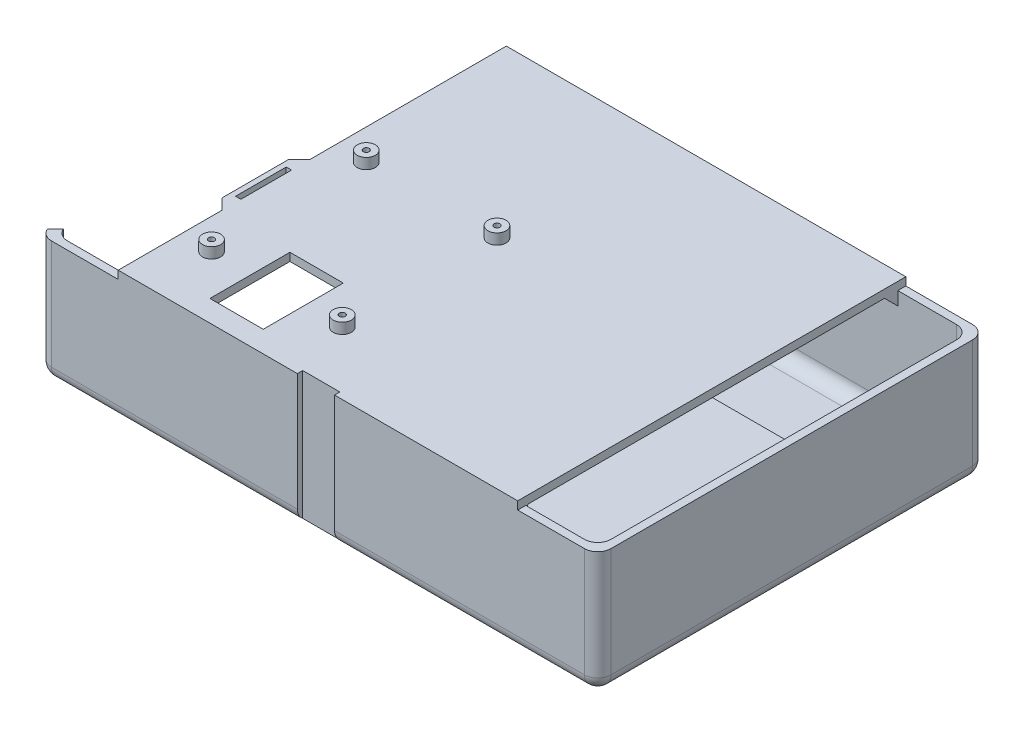
from build123d import *

# Parameters (mm, degrees)
SKETCH1_W           = 209.76981502
SKETCH1_H           = 145.49880751
BOSS_EXTRUDE1_DEPTH = 3
SKETCH2_W           = 209.76981502
SKETCH2_H           = 145.49880751
SKETCH2_W_2         = 203.76981502
SKETCH2_H_2         = 139.49880751
BOSS_EXTRUDE2_DEPTH = 43
CUT_EXTRUDE1_REACH  = 237.338
SKETCH3_W           = 128.479051628
SKETCH3_H           = 43
FILLET1_R           = 5
FILLET2_R           = 5
SKETCH4_W           = 149.76981502
SKETCH4_H           = 145.49880751
BOSS_EXTRUDE3_DEPTH = 3
SKETCH6_R           = 3.4
SKETCH6_R_2         = 1.1
BOSS_EXTRUDE4_DEPTH = 4
CUT_EXTRUDE3_REACH  = 159.189
CUT_EXTRUDE4_REACH  = 157.634
SKETCH6_3_R         = 1.1
SKETCH10_W          = 13.938
SKETCH10_H          = 2
CUT_EXTRUDE7_DEPTH  = 49
BOSS_EXTRUDE7_DEPTH = 3
CHAMFER2_SIZE       = 5
BOSS_EXTRUDE8_DEPTH = 166.769815019
CUT_EXTRUDE8_REACH  = 189.845
CHAMFER3_SIZE       = 5
CHAMFER4_SIZE       = 1
CUT_EXTRUDE9_REACH  = 157.634
SKETCH14_W          = 20
SKETCH14_H          = 30
CHAMFER5_SIZE       = 2
CUT_EXTRUDE11_REACH = 152.937


with BuildPart() as part:
    # Sketch1 → Boss-Extrude1 (new body)
    with BuildSketch(Plane(origin=(0, 0, 0), x_dir=(1, 0, 0), z_dir=(0, 1, 0))):
        with Locations((-1.81641925, -29.789838466)):
            Rectangle(SKETCH1_W, SKETCH1_H)
    extrude(amount=BOSS_EXTRUDE1_DEPTH)

    # Sketch2 → Boss-Extrude2 (add)
    with BuildSketch(Plane(origin=(0, 3, 0), x_dir=(1, 0, 0), z_dir=(0, 1, 0))):
        with Locations((-1.81641925, -29.789838466)):
            Rectangle(SKETCH2_W, SKETCH2_H)
        with Locations((-1.81641925, -29.789838466)):
            Rectangle(SKETCH2_W_2, SKETCH2_H_2, mode=Mode.SUBTRACT)
    extrude(amount=BOSS_EXTRUDE2_DEPTH)

    # Sketch3 → Cut-Extrude1 (cut, up to next)
    with BuildSketch(Plane(origin=(-103.70132676, 0, 0), x_dir=(0, 0, -1), z_dir=(1, 0, 0)), mode=Mode.PRIVATE) as cut_extrude1_sk1:
        with Locations((-30.028651676, 24.5)):
            Rectangle(SKETCH3_W, SKETCH3_H)
    cut_extrude1_tool1 = extrude(cut_extrude1_sk1.sketch, amount=-CUT_EXTRUDE1_REACH, mode=Mode.PRIVATE) & part.part
    add(cut_extrude1_tool1.solids().sort_by_distance((-103.701327, 24.5, 30.028652))[0], mode=Mode.SUBTRACT)

    # Fillet1
    fillet1_edges = [part.edges().sort_by_distance(p)[0] for p in [
        (100.06848826, 24.5, -39.959565289),
        (100.06848826, 24.5, 99.539242221),
        (-103.70132676, 24.5, 99.539242221),
        (-103.70132676, 24.5, -39.959565289),
        (-106.70132676, 23, -42.959565289),
        (103.06848826, 23, -42.959565289),
        (103.06848826, 23, 102.539242221),
        (-106.70132676, 23, 102.539242221),
    ]]
    fillet(fillet1_edges, radius=FILLET1_R)

    # Fillet2
    # the kernel refuses this fillet: 5 mm, written as the material it adds along each edge
    with BuildSketch(Plane(origin=(-103.70132676, 3, 94.26817749), x_dir=(0, 1, 0), z_dir=(0, 0, 1))) as fillet2_piece_1:
        with BuildLine():
            CenterArc((FILLET2_R, -FILLET2_R), FILLET2_R, 90, 90)
            Line((0, -FILLET2_R), (0, 0))
            Line((0, 0), (FILLET2_R, 0))
        make_face()
    extrude(amount=0.271064731)
    with BuildSketch(Plane(origin=(-98.70132676, 3, 94.539242221), x_dir=(-1, 0, 0), z_dir=(0, 0, -1))) as fillet2_piece_2:
        with BuildLine():
            CenterArc((5 - FILLET2_R, FILLET2_R), FILLET2_R, 270, 90)
            Line((5 - FILLET2_R, 0), (5, 0))
            Line((5, 0), (5, FILLET2_R))
        make_face()
    revolve(axis=Axis((-98.70132676, 3, 94.539242221), (0, 1, 0)), revolution_arc=90)
    with BuildSketch(Plane(origin=(-98.70132676, 3, 99.539242221), x_dir=(0, 1, 0), z_dir=(1, 0, 0)), Plane(origin=(95.06848826, 3, -39.959565289), x_dir=(0, 1, 0), z_dir=(-1, 0, 0))) as fillet2_piece_3:
        with BuildLine():
            CenterArc((FILLET2_R, -FILLET2_R), FILLET2_R, 90, 90)
            Line((0, -FILLET2_R), (0, 0))
            Line((0, 0), (FILLET2_R, 0))
        make_face()
    extrude(amount=193.769815019)
    with BuildSketch(Plane(origin=(95.06848826, 3, 94.539242221), x_dir=(0, 0, 1), z_dir=(-1, 0, 0))) as fillet2_piece_4:
        with BuildLine():
            CenterArc((5 - FILLET2_R, FILLET2_R), FILLET2_R, 270, 90)
            Line((5 - FILLET2_R, 0), (5, 0))
            Line((5, 0), (5, FILLET2_R))
        make_face()
    revolve(axis=Axis((95.06848826, 3, 94.539242221), (0, 1, 0)), revolution_arc=90)
    with BuildSketch(Plane(origin=(100.06848826, 3, 94.539242221), x_dir=(0, 1, 0), z_dir=(0, 0, -1))) as fillet2_piece_5:
        with BuildLine():
            CenterArc((FILLET2_R, -FILLET2_R), FILLET2_R, 90, 90)
            Line((0, -FILLET2_R), (0, 0))
            Line((0, 0), (FILLET2_R, 0))
        make_face()
    extrude(amount=129.49880751)
    with BuildSketch(Plane(origin=(95.06848826, 3, -34.959565289), x_dir=(1, 0, 0), z_dir=(0, 0, 1))) as fillet2_piece_6:
        with BuildLine():
            CenterArc((5 - FILLET2_R, FILLET2_R), FILLET2_R, 270, 90)
            Line((5 - FILLET2_R, 0), (5, 0))
            Line((5, 0), (5, FILLET2_R))
        make_face()
    revolve(axis=Axis((95.06848826, 3, -34.959565289), (0, 1, 0)), revolution_arc=90)
    with BuildSketch(Plane(origin=(-103.70132676, 3, -34.959565289), x_dir=(0, 1, 0), z_dir=(0, 0, 1))) as fillet2_piece_7:
        with BuildLine():
            CenterArc((FILLET2_R, -FILLET2_R), FILLET2_R, 90, 90)
            Line((0, -FILLET2_R), (0, 0))
            Line((0, 0), (FILLET2_R, 0))
        make_face()
    extrude(amount=0.748691151)
    with BuildSketch(Plane(origin=(-98.70132676, 3, -34.959565289), x_dir=(0, 0, -1), z_dir=(1, 0, 0))) as fillet2_piece_8:
        with BuildLine():
            CenterArc((5 - FILLET2_R, FILLET2_R), FILLET2_R, 270, 90)
            Line((5 - FILLET2_R, 0), (5, 0))
            Line((5, 0), (5, FILLET2_R))
        make_face()
    revolve(axis=Axis((-98.70132676, 3, -34.959565289), (0, 1, 0)), revolution_arc=90)
    # the kernel refuses this fillet: 5 mm, written as the material it takes off along each edge
    with BuildSketch(Plane(origin=(-101.70132676, 0, 97.539242221), x_dir=(0, 0, 1), z_dir=(1, 0, 0))) as fillet2_2_piece_1:
        with BuildLine():
            CenterArc((5 - FILLET2_R, -FILLET2_R), FILLET2_R, 0, 90)
            Line((5, -FILLET2_R), (5, 0))
            Line((5, 0), (5 - FILLET2_R, 0))
        make_face()
    revolve(axis=Axis((-101.70132676, 0, 97.539242221), (0, -1, 0)), revolution_arc=90, mode=Mode.SUBTRACT)
    with BuildSketch(Plane(origin=(-106.70132676, 0, 97.539242221), x_dir=(1, 0, 0), z_dir=(0, 0, -1)), Plane(origin=(103.06848826, 0, -37.959565289), x_dir=(-1, 0, 0), z_dir=(0, 0, 1))) as fillet2_2_piece_2:
        with BuildLine():
            CenterArc((FILLET2_R, -FILLET2_R), FILLET2_R, 90, 90)
            Line((0, -FILLET2_R), (0, 0))
            Line((0, 0), (FILLET2_R, 0))
        make_face()
    extrude(amount=135.49880751, mode=Mode.SUBTRACT)
    with BuildSketch(Plane(origin=(-101.70132676, 0, -37.959565289), x_dir=(-1, 0, 0), z_dir=(0, 0, 1))) as fillet2_2_piece_3:
        with BuildLine():
            CenterArc((5 - FILLET2_R, -FILLET2_R), FILLET2_R, 0, 90)
            Line((5, -FILLET2_R), (5, 0))
            Line((5, 0), (5 - FILLET2_R, 0))
        make_face()
    revolve(axis=Axis((-101.70132676, 0, -37.959565289), (0, -1, 0)), revolution_arc=90, mode=Mode.SUBTRACT)
    with BuildSketch(Plane(origin=(-101.70132676, 0, -42.959565289), x_dir=(0, 0, 1), z_dir=(1, 0, 0))) as fillet2_2_piece_4:
        with BuildLine():
            CenterArc((FILLET2_R, -FILLET2_R), FILLET2_R, 90, 90)
            Line((0, -FILLET2_R), (0, 0))
            Line((0, 0), (FILLET2_R, 0))
        make_face()
    extrude(amount=199.769815019, mode=Mode.SUBTRACT)
    with BuildSketch(Plane(origin=(98.06848826, 0, -37.959565289), x_dir=(1, 0, 0), z_dir=(0, 0, 1))) as fillet2_2_piece_5:
        with BuildLine():
            CenterArc((5 - FILLET2_R, FILLET2_R), FILLET2_R, 270, 90)
            Line((5, FILLET2_R), (5, 0))
            Line((5, 0), (5 - FILLET2_R, 0))
        make_face()
    revolve(axis=Axis((98.06848826, 0, -37.959565289), (0, 1, 0)), revolution_arc=90, mode=Mode.SUBTRACT)
    with BuildSketch(Plane(origin=(98.06848826, 0, 97.539242221), x_dir=(0, 0, 1), z_dir=(-1, 0, 0))) as fillet2_2_piece_6:
        with BuildLine():
            CenterArc((5 - FILLET2_R, FILLET2_R), FILLET2_R, 270, 90)
            Line((5, FILLET2_R), (5, 0))
            Line((5, 0), (5 - FILLET2_R, 0))
        make_face()
    revolve(axis=Axis((98.06848826, 0, 97.539242221), (0, 1, 0)), revolution_arc=90, mode=Mode.SUBTRACT)
    with BuildSketch(Plane(origin=(98.06848826, 0, 102.539242221), x_dir=(0, 1, 0), z_dir=(-1, 0, 0))) as fillet2_2_piece_7:
        with BuildLine():
            CenterArc((FILLET2_R, FILLET2_R), FILLET2_R, 180, 90)
            Line((0, FILLET2_R), (0, 0))
            Line((0, 0), (FILLET2_R, 0))
        make_face()
    extrude(amount=199.769815019, mode=Mode.SUBTRACT)

    # Sketch4 → Boss-Extrude3 (add)
    with BuildSketch(Plane(origin=(0, 46, 0), x_dir=(1, 0, 0), z_dir=(0, 1, 0))):
        with Locations((-1.81641925, -29.789838466)):
            Rectangle(SKETCH4_W, SKETCH4_H)
    extrude(amount=BOSS_EXTRUDE3_DEPTH)

    # Sketch6 → Boss-Extrude4 (add)
    # profile 1 of 4: a face of its own
    with BuildSketch(Plane(origin=(0, 49, 0), x_dir=(1, 0, 0), z_dir=(0, 1, 0))):
        with Locations(Location((-65.20132676, -21.039242221, 0), (0, 0, 90))):
            Circle(SKETCH6_R)
        with Locations(Location((-65.20132676, -21.039242221, 0), (0, 0, 270))):
            Circle(SKETCH6_R_2, mode=Mode.SUBTRACT)
    # profile 2 of 4: a face of its own
    with BuildSketch(Plane(origin=(0, 49, 0), x_dir=(1, 0, 0), z_dir=(0, 1, 0))):
        with Locations(Location((-65.20132676, -79.039242221, 0), (0, 0, 90))):
            Circle(SKETCH6_R)
        with Locations(Location((-65.20132676, -79.039242221, 0), (0, 0, 270))):
            Circle(SKETCH6_R_2, mode=Mode.SUBTRACT)
    # profile 3 of 4: a face of its own
    with BuildSketch(Plane(origin=(0, 49, 0), x_dir=(1, 0, 0), z_dir=(0, 1, 0))):
        with Locations(Location((-16.20132676, -21.039242221, 0), (0, 0, 90))):
            Circle(SKETCH6_R)
        with Locations(Location((-16.20132676, -21.039242221, 0), (0, 0, 270))):
            Circle(SKETCH6_R_2, mode=Mode.SUBTRACT)
    # profile 4 of 4: a face of its own
    with BuildSketch(Plane(origin=(0, 49, 0), x_dir=(1, 0, 0), z_dir=(0, 1, 0))):
        with Locations(Location((-16.20132676, -79.039242221, 0), (0, 0, 90))):
            Circle(SKETCH6_R)
        with Locations(Location((-16.20132676, -79.039242221, 0), (0, 0, 270))):
            Circle(SKETCH6_R_2, mode=Mode.SUBTRACT)
    extrude(amount=BOSS_EXTRUDE4_DEPTH)

    # Cut-Extrude3: up to this face of the body (flat: up to its plane)
    cut_extrude3_end = Plane(part.part.faces().sort_by_distance((-1.81641925, 46, 29.789838466))[0])
    # Sketch7 → Cut-Extrude3 (cut, up to the picked face)
    with BuildSketch(Plane(origin=(0, 0, 0), x_dir=(1, 0, 0), z_dir=(0, 1, 0)), mode=Mode.PRIVATE) as cut_extrude3_sk1:
        Polygon((-109.450730514, 42.959565289), (-106.825730514, 40.334565289), (-98.82632676, 32.335161534), (-66.70132676, 0.210161534), (-66.70132676, -59.789838466), (-99.07632676, -92.164838466), (-107.075730514, -100.164242221), (-109.450730514, -102.539242221), align=None)
    cut_extrude3_tool1 = split(extrude(cut_extrude3_sk1.sketch, amount=CUT_EXTRUDE3_REACH, mode=Mode.PRIVATE), bisect_by=cut_extrude3_end, keep=Keep.BOTH, mode=Mode.PRIVATE)
    add(cut_extrude3_tool1.solids().sort_by(Axis((-91.040379, 0, 29.789838), (0, 1, 0)))[0], mode=Mode.SUBTRACT)

    # Sketch6<3> → Cut-Extrude4 (cut, up to next)
    with BuildSketch(Plane(origin=(0, 49, 0), x_dir=(1, 0, 0), z_dir=(0, 1, 0)), mode=Mode.PRIVATE) as cut_extrude4_sk1:
        with Locations(Location((-65.20132676, -79.039242221, 0), (0, 0, 90))):
            Circle(SKETCH6_3_R)
    cut_extrude4_tool1 = extrude(cut_extrude4_sk1.sketch, amount=-CUT_EXTRUDE4_REACH, mode=Mode.PRIVATE) & part.part
    # Sketch6<3> → Cut-Extrude4 (cut, up to next)
    with BuildSketch(Plane(origin=(0, 49, 0), x_dir=(1, 0, 0), z_dir=(0, 1, 0)), mode=Mode.PRIVATE) as cut_extrude4_sk2:
        with Locations(Location((-65.20132676, -21.039242221, 0), (0, 0, 90))):
            Circle(SKETCH6_3_R)
    cut_extrude4_tool2 = extrude(cut_extrude4_sk2.sketch, amount=-CUT_EXTRUDE4_REACH, mode=Mode.PRIVATE) & part.part
    # Sketch6<3> → Cut-Extrude4 (cut, up to next)
    with BuildSketch(Plane(origin=(0, 49, 0), x_dir=(1, 0, 0), z_dir=(0, 1, 0)), mode=Mode.PRIVATE) as cut_extrude4_sk3:
        with Locations(Location((-16.20132676, -21.039242221, 0), (0, 0, 90))):
            Circle(SKETCH6_3_R)
    cut_extrude4_tool3 = extrude(cut_extrude4_sk3.sketch, amount=-CUT_EXTRUDE4_REACH, mode=Mode.PRIVATE) & part.part
    # Sketch6<3> → Cut-Extrude4 (cut, up to next)
    with BuildSketch(Plane(origin=(0, 49, 0), x_dir=(1, 0, 0), z_dir=(0, 1, 0)), mode=Mode.PRIVATE) as cut_extrude4_sk4:
        with Locations(Location((-16.20132676, -79.039242221, 0), (0, 0, 90))):
            Circle(SKETCH6_3_R)
    cut_extrude4_tool4 = extrude(cut_extrude4_sk4.sketch, amount=-CUT_EXTRUDE4_REACH, mode=Mode.PRIVATE) & part.part
    add(cut_extrude4_tool1.solids().sort_by_distance((-65.201327, 49, 79.039242))[0], mode=Mode.SUBTRACT)
    add(cut_extrude4_tool2.solids().sort_by_distance((-65.201327, 49, 21.039242))[0], mode=Mode.SUBTRACT)
    add(cut_extrude4_tool3.solids().sort_by_distance((-16.201327, 49, 21.039242))[0], mode=Mode.SUBTRACT)
    add(cut_extrude4_tool4.solids().sort_by_distance((-16.201327, 49, 79.039242))[0], mode=Mode.SUBTRACT)

    # Sketch10 → Cut-Extrude7 (cut)
    with BuildSketch(Plane(origin=(0, 0, 0), x_dir=(1, 0, 0), z_dir=(0, 1, 0))):
        with Locations((-2.56641925, -101.539242221)):
            Rectangle(SKETCH10_W, SKETCH10_H)
    extrude(amount=CUT_EXTRUDE7_DEPTH, mode=Mode.SUBTRACT)

    # Sketch11 → Boss-Extrude7 (add)
    with BuildSketch(Plane(origin=(0, 49, 0), x_dir=(1, 0, 0), z_dir=(0, 1, 0))):
        Polygon((-76.70132676, -35.539242221), (-80.70132676, -35.539242221), (-80.70132676, -58.539242221), (-76.70132676, -58.539242221), (-76.70132676, -56.539242221), (-78.70132676, -56.539242221), (-78.70132676, -37.539242221), (-76.70132676, -37.539242221), align=None)
    extrude(amount=-BOSS_EXTRUDE7_DEPTH)

    # Chamfer2
    # the kernel refuses this chamfer: 5 mm, written as the material it adds along each edge
    with BuildSketch(Plane(origin=(-76.70132676, 49, 35.539242221), x_dir=(0.027495876610587663, 0, -0.9996219169112968), z_dir=(0, -1, 0))) as chamfer2_piece_1_section:
        Polygon((CHAMFER2_SIZE * 0.999621916911, -CHAMFER2_SIZE * 0.0274958766106), (-CHAMFER2_SIZE * 0.0274958766106, -CHAMFER2_SIZE * 0.999621916911), (0, 0), align=None)
    chamfer2_piece_1 = extrude(amount=3, mode=Mode.PRIVATE)
    chamfer2_piece_1 = split(chamfer2_piece_1, bisect_by=Plane(origin=(-80.70132676, 47.5, 33.810650159), z_dir=(1, 0, 0)), keep=Keep.TOP, mode=Mode.PRIVATE)
    add(chamfer2_piece_1)
    with BuildSketch(Plane(origin=(-76.70132676, 49, 58.539242221), x_dir=(0.0274958766105877, 0, 0.9996219169112968), z_dir=(0, -1, 0))) as chamfer2_piece_2_section:
        Polygon((CHAMFER2_SIZE * 0.999621916911, CHAMFER2_SIZE * 0.0274958766106), (-CHAMFER2_SIZE * 0.0274958766106, CHAMFER2_SIZE * 0.999621916911), (0, 0), align=None)
    chamfer2_piece_2 = extrude(amount=3, mode=Mode.PRIVATE)
    chamfer2_piece_2 = split(chamfer2_piece_2, bisect_by=Plane(origin=(-80.70132676, 47.5, 60.267834282), z_dir=(1, 0, 0)), keep=Keep.TOP, mode=Mode.PRIVATE)
    add(chamfer2_piece_2)

    # Sketch12 → Boss-Extrude8 (add)
    with BuildSketch(Plane.ZY.offset(-100.06848826)):
        Polygon((14.539242221, 3), (14.539242221, 31), (99.539242221, 31), (99.539242221, 28), (17.539242221, 28), (17.539242221, 3), align=None)
    extrude(amount=BOSS_EXTRUDE8_DEPTH)

    # Sketch13 → Cut-Extrude8 (cut, up to next)
    with BuildSketch(Plane(origin=(0, 0, -42.959565289), x_dir=(-1, 0, 0), z_dir=(0, 0, -1)), mode=Mode.PRIVATE) as cut_extrude8_sk1:
        Polygon((76.70132676, 46), (106.333358026, 46), (106.333358026, 0), align=None)
    cut_extrude8_tool1 = extrude(cut_extrude8_sk1.sketch, amount=-CUT_EXTRUDE8_REACH, mode=Mode.PRIVATE) & part.part
    add(cut_extrude8_tool1.solids().sort_by_distance((-96.456014, 30.666667, -42.959565))[0], mode=Mode.SUBTRACT)

    # Chamfer3
    chamfer3_edges = [part.edges().sort_by_distance(p)[0] for p in [
        (-1.81641925, 46, -39.959565289),
    ]]
    chamfer(chamfer3_edges, length=CHAMFER3_SIZE)

    # Chamfer4
    # the kernel refuses this chamfer: 1 mm, written as the material it adds along each edge
    with BuildSketch(Plane(origin=(-76.70132676, 46, 99.539242221), x_dir=(0, 0.027495876610589196, -0.9996219169112968), z_dir=(1, 0, 0))) as chamfer4_piece_1:
        Polygon((CHAMFER4_SIZE * 0.999621916911, -CHAMFER4_SIZE * 0.0274958766106), (-CHAMFER4_SIZE * 0.0274958766106, -CHAMFER4_SIZE * 0.999621916911), (0, 0), align=None)
    extrude(amount=149.769815019)

    # Cut-Extrude9: up to this face of the body (flat: up to its plane)
    cut_extrude9_end = Plane(part.part.faces().sort_by_distance((16.651292548, 28, 58.523589057))[0])
    # Sketch14 → Cut-Extrude9 (cut, up to the picked face)
    with BuildSketch(Plane(origin=(0, 49, 0), x_dir=(1, 0, 0), z_dir=(0, 1, 0)), mode=Mode.PRIVATE) as cut_extrude9_sk1:
        with Locations((-40.322572785, -79.539242221)):
            Rectangle(SKETCH14_W, SKETCH14_H)
    cut_extrude9_tool1 = split(extrude(cut_extrude9_sk1.sketch, amount=-CUT_EXTRUDE9_REACH, mode=Mode.PRIVATE), bisect_by=cut_extrude9_end, keep=Keep.BOTH, mode=Mode.PRIVATE)
    add(cut_extrude9_tool1.solids().sort_by(Axis((-40.322573, 49, 79.539242), (0, -1, 0)))[0], mode=Mode.SUBTRACT)

    # Chamfer5
    chamfer5_edges = [part.edges().sort_by_distance(p)[0] for p in [
        (98.604022166, 4.464466094, 14.539242221),
        (98.604022166, 31, 98.074776126),
        (14.18358075, 31, 99.539242221),
        (100.06848826, 31, 54.539242221),
        (100.06848826, 19.5, 14.539242221),
        (14.18358075, 3, 14.539242221),
    ]]
    chamfer(chamfer5_edges, length=CHAMFER5_SIZE)

    # Sketch16 → Cut-Extrude11 (cut, up to next)
    with BuildSketch(Plane(origin=(0, 31, 0), x_dir=(1, 0, 0), z_dir=(0, 1, 0)), mode=Mode.PRIVATE) as cut_extrude11_sk1:
        Polygon((-50.322572785, -94.539242221), (-66.70132676, -94.539242221), (-66.70132676, -28.160488246), (-30.322572785, -64.539242221), (-50.322572785, -64.539242221), align=None)
    cut_extrude11_tool1 = extrude(cut_extrude11_sk1.sketch, amount=-CUT_EXTRUDE11_REACH, mode=Mode.PRIVATE) & part.part
    add(cut_extrude11_tool1.solids().sort_by_distance((-56.252713, 31, 63.972421))[0], mode=Mode.SUBTRACT)


solid = part.part
